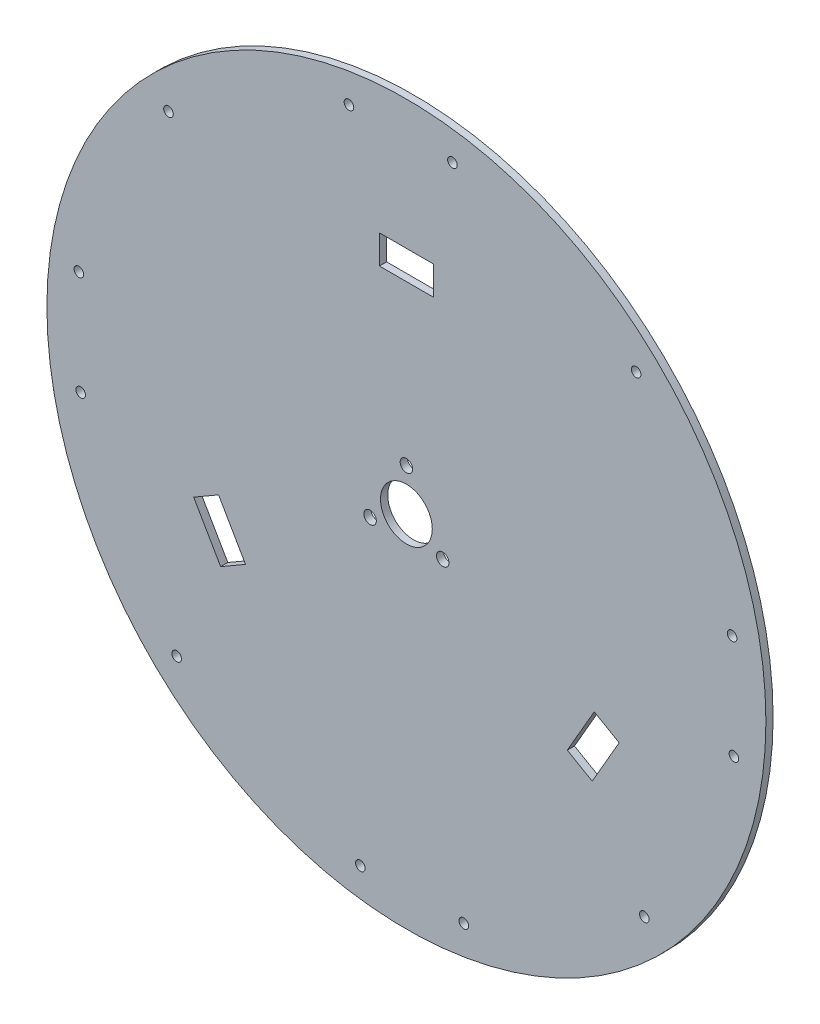
from build123d import *

# Parameters (mm, degrees)
CROQUIS1_R              = 150
CROQUIS1_R_2            = 10.8
CROQUIS1_R_3            = 2.6
CROQUIS1_W              = 22.5
CROQUIS1_H              = 12
SALIENTE_EXTRUIR1_DEPTH = 3
CROQUIS3_R              = 2
CORTAR_EXTRUIR1_DEPTH   = 213.153246499


with BuildPart() as part:
    # Croquis1 → Saliente-Extruir1 (new body)
    with BuildSketch(Plane.XY):
        Circle(CROQUIS1_R)
        Circle(CROQUIS1_R_2, mode=Mode.SUBTRACT)
        with Locations((0, 17.5)):
            Circle(CROQUIS1_R_3, mode=Mode.SUBTRACT)
        with Locations((15.155444566, -8.75)):
            Circle(CROQUIS1_R_3, mode=Mode.SUBTRACT)
        with Locations((-15.155444566, -8.75)):
            Circle(CROQUIS1_R_3, mode=Mode.SUBTRACT)
        with Locations((0, 90)):
            Rectangle(CROQUIS1_W, CROQUIS1_H, mode=Mode.SUBTRACT)
        Polygon((88.763438763, -38.257214207), (78.371133918, -32.257214207), (67.121133918, -51.742785793), (77.513438763, -57.742785793), align=None, mode=Mode.SUBTRACT)
        Polygon((-77.513438763, -57.742785793), (-67.121133918, -51.742785793), (-78.371133918, -32.257214207), (-88.763438763, -38.257214207), align=None, mode=Mode.SUBTRACT)
    extrude(amount=SALIENTE_EXTRUIR1_DEPTH)

    # Croquis3 → Cortar-Extruir1 (cut, through all)
    with BuildSketch(Plane.XY.offset(3)):
        with Locations((-99.268892447, 95.862855123)):
            Circle(CROQUIS3_R)
        with Locations((-23.963448518, 135.903469916)):
            Circle(CROQUIS3_R)
        with Locations((19.205887932, 136.656993486)):
            Circle(CROQUIS3_R)
        with Locations((95.862855123, 99.268892447)):
            Circle(CROQUIS3_R)
        with Locations((135.903469916, 23.963448518)):
            Circle(CROQUIS3_R)
        with Locations((136.656993486, -19.205887932)):
            Circle(CROQUIS3_R)
        with Locations((99.268892447, -95.862855123)):
            Circle(CROQUIS3_R)
        with Locations((23.963448518, -135.903469916)):
            Circle(CROQUIS3_R)
        with Locations((-19.205887932, -136.656993486)):
            Circle(CROQUIS3_R)
        with Locations((-95.862855123, -99.268892447)):
            Circle(CROQUIS3_R)
        with Locations((-135.903469916, -23.963448518)):
            Circle(CROQUIS3_R)
        with Locations((-136.656993486, 19.205887932)):
            Circle(CROQUIS3_R)
    extrude(amount=-CORTAR_EXTRUIR1_DEPTH, mode=Mode.SUBTRACT)


solid = part.part
